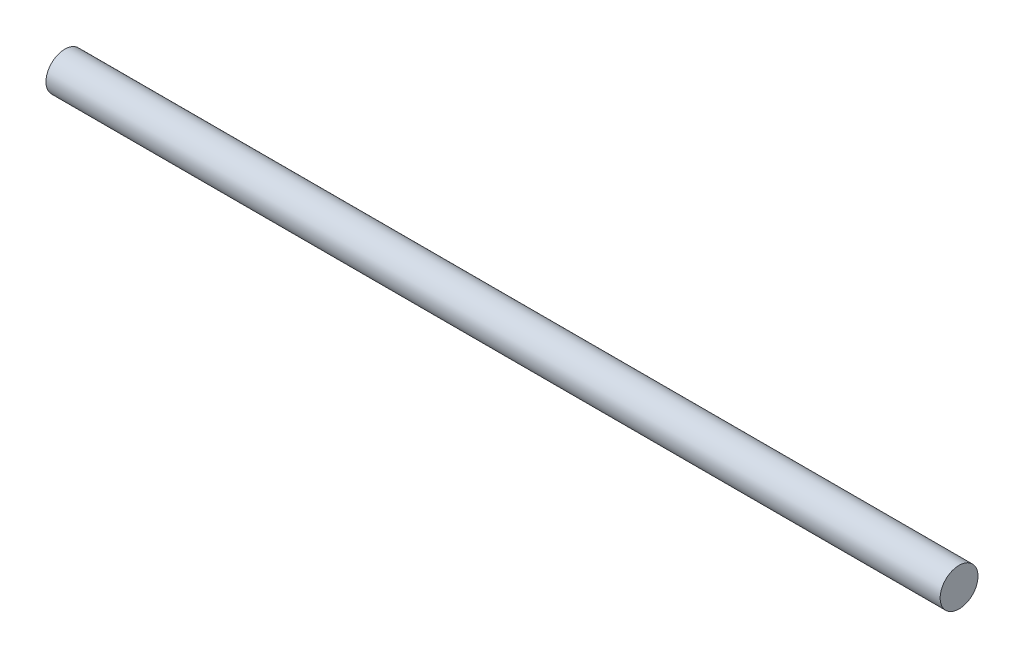
from build123d import *

# Parameters (mm, degrees)
SKETCH1_R           = 3.175
BOSS_EXTRUDE1_DEPTH = 75


with BuildPart() as part:
    # Sketch1 → Boss-Extrude1 (new, symmetric)
    with BuildSketch(Plane(origin=(0, 0, 0), x_dir=(0, 0, -1), z_dir=(1, 0, 0))):
        Circle(SKETCH1_R)
    extrude(amount=BOSS_EXTRUDE1_DEPTH, both=True)


solid = part.part
